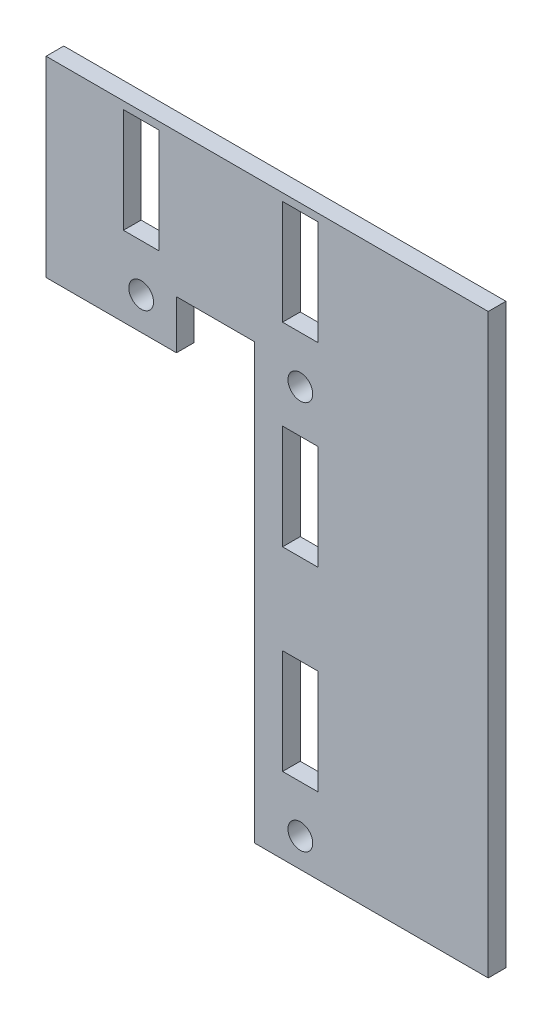
from build123d import *

# Parameters (mm, degrees)
SKETCH1_W           = 101.6
SKETCH1_H           = 50.8
BOSS_EXTRUDE1_DEPTH = 2.54
SKETCH2_R           = 1.778
CUT_EXTRUDE1_DEPTH  = 57.852894385
SKETCH3_W           = 5.1
SKETCH3_H           = 15.02
CUT_EXTRUDE4_DEPTH  = 57.852894385
CUT_EXTRUDE5_DEPTH  = 57.852894385
SKETCH6_W           = 12.7
SKETCH6_H           = 82.902
BOSS_EXTRUDE5_DEPTH = 2.54


with BuildPart() as part:
    # Sketch1 → Boss-Extrude1 (new body)
    with BuildSketch(Plane(origin=(0, 0, 0), x_dir=(0, 1, 0), z_dir=(0, 0, 1))):
        Rectangle(SKETCH1_W, SKETCH1_H)
    extrude(amount=BOSS_EXTRUDE1_DEPTH)

    # Sketch2 → Cut-Extrude1 (cut, through all)
    with BuildSketch(Plane.XY.offset(2.54)):
        with Locations((11.115903034, 27.94)):
            Circle(SKETCH2_R)
        with Locations((11.115903034, -27.94)):
            Circle(SKETCH2_R)
        with Locations((-11.744096966, 27.94)):
            Circle(SKETCH2_R)
    extrude(amount=-CUT_EXTRUDE1_DEPTH, mode=Mode.SUBTRACT)

    # Sketch3 → Cut-Extrude4 (cut, through all)
    with BuildSketch(Plane.XY.offset(2.54)):
        with Locations((11.115903034, -13.67)):
            Rectangle(SKETCH3_W, SKETCH3_H)
        with Locations((11.115903034, 14.27)):
            Rectangle(SKETCH3_W, SKETCH3_H)
        with Locations((11.115903034, 42.21)):
            Rectangle(SKETCH3_W, SKETCH3_H)
        with Locations((-11.744096966, 42.21)):
            Rectangle(SKETCH3_W, SKETCH3_H)
    extrude(amount=-CUT_EXTRUDE4_DEPTH, mode=Mode.SUBTRACT)

    # Sketch5 → Cut-Extrude5 (cut, through all)
    with BuildSketch(Plane.XY.offset(2.54)):
        Polygon((4.501903034, -32.102), (4.501903034, 30.255), (-6.674096966, 30.255), (-6.674096966, 23.27), (-25.4, 23.27), (-25.4, -50.8), (25.4, -50.8), (25.4, -32.102), align=None)
    extrude(amount=-CUT_EXTRUDE5_DEPTH, mode=Mode.SUBTRACT)

    # Sketch6 → Boss-Extrude5 (add)
    with BuildSketch(Plane.XY.offset(2.54)):
        with Locations((31.75, 9.349)):
            Rectangle(SKETCH6_W, SKETCH6_H)
    extrude(amount=-BOSS_EXTRUDE5_DEPTH)


solid = part.part
